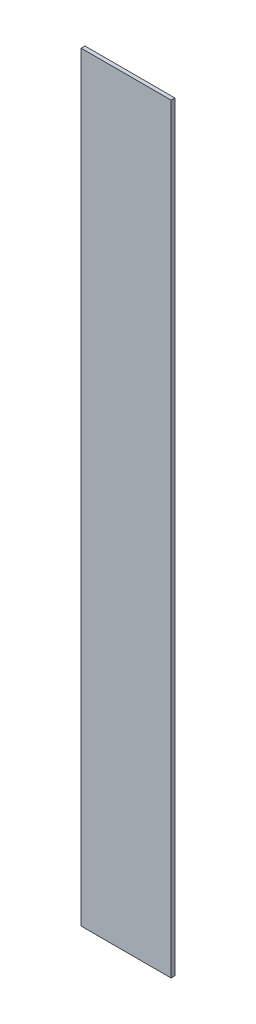
from build123d import *

# Parameters (mm, degrees)
SKETCH1_W           = 75.050000014
SKETCH1_H           = 635
BOSS_EXTRUDE1_DEPTH = 3.175


with BuildPart() as part:
    # Sketch1 → Boss-Extrude1 (new body)
    with BuildSketch(Plane.XY):
        Rectangle(SKETCH1_W, SKETCH1_H)
    extrude(amount=BOSS_EXTRUDE1_DEPTH)


solid = part.part
